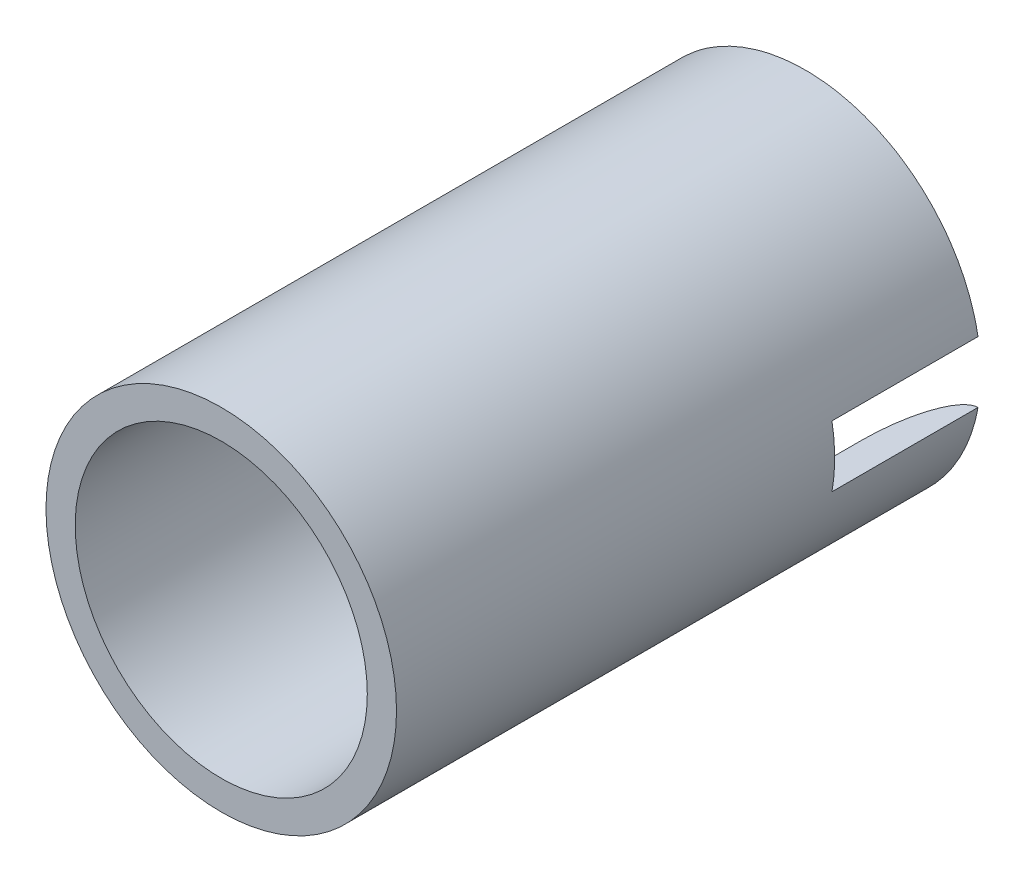
from build123d import *

# Parameters (mm, degrees)
SKETCH1_R           = 6
SKETCH1_R_2         = 5
BOSS_EXTRUDE1_DEPTH = 20
SKETCH2_W           = 17.887562732
SKETCH2_H           = 2.1
CUT_EXTRUDE1_DEPTH  = 5
FILLET2_SIZE        = 1
FILLET2_SIZE_2      = 3


with BuildPart() as part:
    # Sketch1 → Boss-Extrude1 (new body)
    with BuildSketch(Plane.XY):
        Circle(SKETCH1_R)
        Circle(SKETCH1_R_2, mode=Mode.SUBTRACT)
    extrude(amount=BOSS_EXTRUDE1_DEPTH)

    # Sketch2 → Cut-Extrude1 (cut)
    with BuildSketch(Plane(origin=(0, 0, 0), x_dir=(-1, 0, 0), z_dir=(0, 0, -1))):
        Rectangle(SKETCH2_W, SKETCH2_H)
    extrude(amount=-CUT_EXTRUDE1_DEPTH, mode=Mode.SUBTRACT)

    # Fillet2
    # a fillet whose section is not a circle: 3, 1 mm, written as the material it takes off along each edge
    with BuildSketch(Plane(origin=(0, 0, 0), x_dir=(-0.2768991619260433, 0.9608989822685082, 0), z_dir=(0.9608989822685082, 0.2768991619260433, 0))) as fillet2_piece_1:
        with BuildLine():
            Bezier((5 + FILLET2_SIZE, 0), (5, 0), (5, FILLET2_SIZE_2), weights=[1, 0.707106781, 1])
            Line((5, FILLET2_SIZE_2), (5, 0))
            Line((5, 0), (5 + FILLET2_SIZE, 0))
        make_face()
    revolve(axis=Axis((0, 0, 0), (0, 0, 1)), revolution_arc=327.849552319, mode=Mode.SUBTRACT)
    with BuildSketch(Plane(origin=(0, 0, 0), x_dir=(0.2768991619260793, -0.9608989822684979, 0), z_dir=(-0.9608989822684979, -0.2768991619260793, 0))) as fillet2_piece_2:
        with BuildLine():
            Bezier((5 + FILLET2_SIZE, 0), (5, 0), (5, FILLET2_SIZE_2), weights=[1, 0.707106781, 1])
            Line((5, FILLET2_SIZE_2), (5, 0))
            Line((5, 0), (5 + FILLET2_SIZE, 0))
        make_face()
    revolve(axis=Axis((0, 0, 0), (0, 0, 1)), revolution_arc=327.849552319, mode=Mode.SUBTRACT)


solid = part.part
